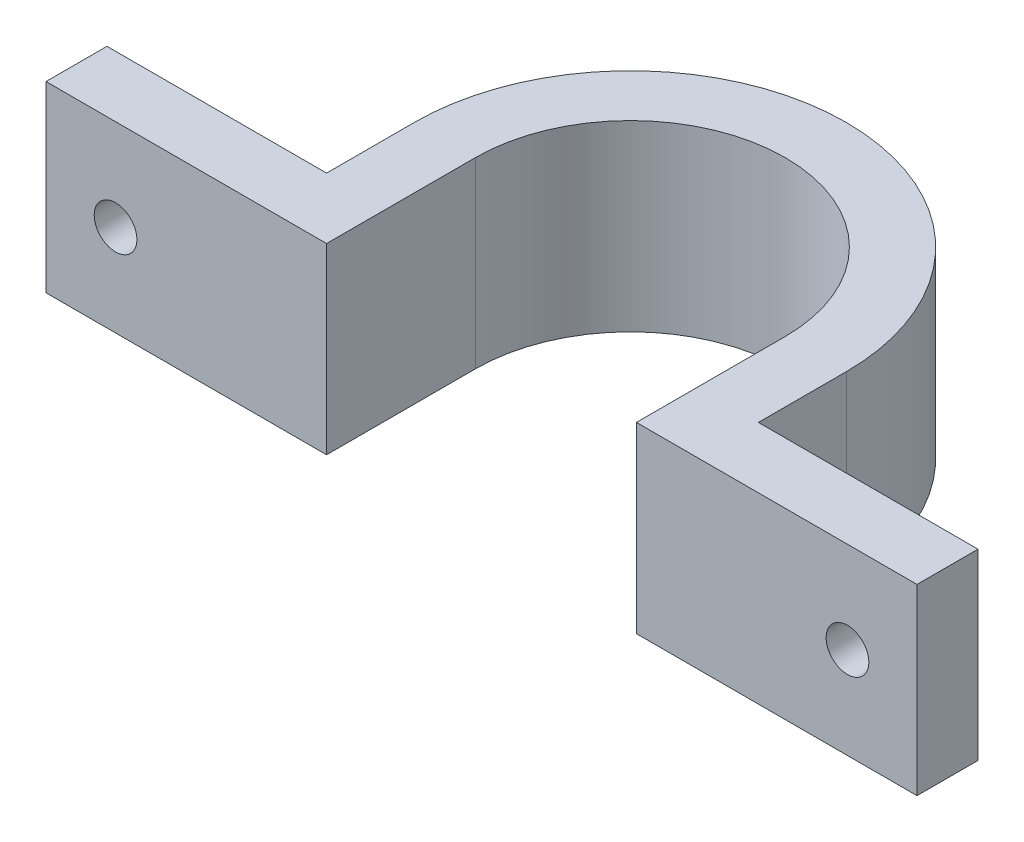
from build123d import *

# Parameters (mm, degrees)
BOSS_EXTRUDE1_DEPTH = 15
SKETCH2_R           = 1.75
CUT_EXTRUDE1_DEPTH  = 47.03802776


with BuildPart() as part:
    # Sketch1 → Boss-Extrude1 (new body)
    with BuildSketch(Plane(origin=(0, 0, 0), x_dir=(1, 0, 0), z_dir=(0, 1, 0))):
        with BuildLine():
            Line((-35.7, -7.2), (-35.7, -12.2))
            Line((-35.7, -12.2), (-12.7, -12.2))
            Line((-12.7, -12.2), (-12.7, 0))
            ThreePointArc((-12.7, 0), (0, 12.7), (12.7, 0))
            Line((12.7, 0), (12.7, -12.2))
            Line((12.7, -12.2), (35.7, -12.2))
            Line((35.7, -12.2), (35.7, -7.2))
            Line((35.7, -7.2), (17.7, -7.2))
            Line((17.7, -7.2), (17.7, 0))
            ThreePointArc((17.7, 0), (0, 17.7), (-17.7, 0))
            Line((-17.7, 0), (-17.7, -7.2))
            Line((-17.7, -7.2), (-35.7, -7.2))
        make_face()
    extrude(amount=BOSS_EXTRUDE1_DEPTH)

    # Sketch2 → Cut-Extrude1 (cut, through all)
    with BuildSketch(Plane(origin=(0, 0, 7.2), x_dir=(-1, 0, 0), z_dir=(0, 0, -1))):
        with Locations((-30, 7.5)):
            Circle(SKETCH2_R)
        with Locations((30, 7.5)):
            Circle(SKETCH2_R)
    extrude(amount=-CUT_EXTRUDE1_DEPTH, mode=Mode.SUBTRACT)


solid = part.part
